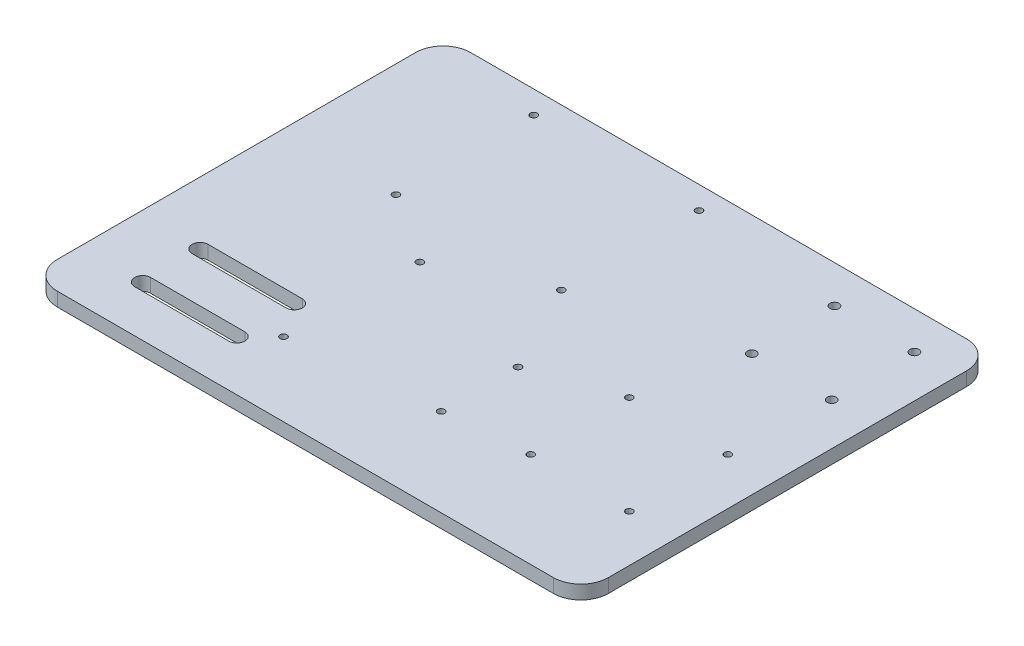
from build123d import *

# Parameters (mm, degrees)
BOSS_EXTRUDE1_DEPTH = 5
ARDUINO_UNO_HOLES_D = 2.5
L298N_HOLES_D       = 2.5
PROTOBOARD_HOLES_D  = 2.5
L_BRACKET_HOLES_D   = 3.3
CUT_EXTRUDE1_DEPTH  = 126.099960032


with BuildPart() as part:
    # Sketch1 → Boss-Extrude1 (new body)
    with BuildSketch(Plane(origin=(0, 0, 0), x_dir=(1, 0, 0), z_dir=(0, 1, 0))):
        with BuildLine():
            Line((-90, -75), (90, -75))
            ThreePointArc((90, -75), (97.071067812, -72.071067812), (100, -65))
            Line((100, -65), (100, 65))
            ThreePointArc((100, 65), (97.071067812, 72.071067812), (90, 75))
            Line((90, 75), (-90, 75))
            ThreePointArc((-90, 75), (-97.071067812, 72.071067812), (-100, 65))
            Line((-100, 65), (-100, -65))
            ThreePointArc((-100, -65), (-97.071067812, -72.071067812), (-90, -75))
        make_face()
    extrude(amount=BOSS_EXTRUDE1_DEPTH)

    # arduino uno holes (through all)
    with Locations(Plane(origin=(0, 5, 0), x_dir=(1, 0, 0), z_dir=(0, 1, 0))):
        with Locations((17.426917584, -15.249784892), (17.426917584, -43.149784892), (-33.373082416, -0.049784892), (-34.673082416, -48.249784892)):
            Hole(ARDUINO_UNO_HOLES_D / 2)

    # l298n holes (through all)
    with Locations(Plane(origin=(0, 5, 0), x_dir=(1, 0, 0), z_dir=(0, 1, 0))):
        with Locations((47.201873377, -40.409180512), (82.961873377, -40.409180512), (82.961873377, -4.649180512), (47.201873377, -4.649180512)):
            Hole(L298N_HOLES_D / 2)

    # protoboard holes (through all)
    with Locations(Plane(origin=(0, 5, 0), x_dir=(1, 0, 0), z_dir=(0, 1, 0))):
        with Locations((-58.909900465, 16.774792285), (1.090099535, 16.774792285), (1.090099535, 66.774792285), (-58.909900465, 66.774792285)):
            Hole(PROTOBOARD_HOLES_D / 2)

    # l-bracket holes (through all)
    with Locations(Plane(origin=(0, 5, 0), x_dir=(1, 0, 0), z_dir=(0, 1, 0))):
        with Locations((55.643412477, 61.376909093), (84.643412477, 61.376909093), (84.643412477, 31.376909093), (55.643412477, 31.376909093)):
            Hole(L_BRACKET_HOLES_D / 2)

    # Sketch24 → Cut-Extrude1 (cut, through all)
    with BuildSketch(Plane(origin=(0, 5, 0), x_dir=(1, 0, 0), z_dir=(0, 1, 0))):
        with BuildLine():
            Line((-43.187348705, -38.744450947), (-77.364059075, -38.744450947))
            ThreePointArc((-77.364059075, -38.744450947), (-80.27570389, -35.832806132), (-77.364059075, -32.921161317))
            Line((-77.364059075, -32.921161317), (-43.187348705, -32.921161317))
            ThreePointArc((-43.187348705, -32.921161317), (-40.27570389, -35.832806132), (-43.187348705, -38.744450947))
        make_face()
        with BuildLine():
            Line((-43.187348705, -53.744450947), (-77.364059075, -53.744450947))
            ThreePointArc((-77.364059075, -53.744450947), (-80.27570389, -56.656095762), (-77.364059075, -59.567740577))
            Line((-77.364059075, -59.567740577), (-43.187348705, -59.567740577))
            ThreePointArc((-43.187348705, -59.567740577), (-40.27570389, -56.656095762), (-43.187348705, -53.744450947))
        make_face()
    extrude(amount=-CUT_EXTRUDE1_DEPTH, mode=Mode.SUBTRACT)


solid = part.part
